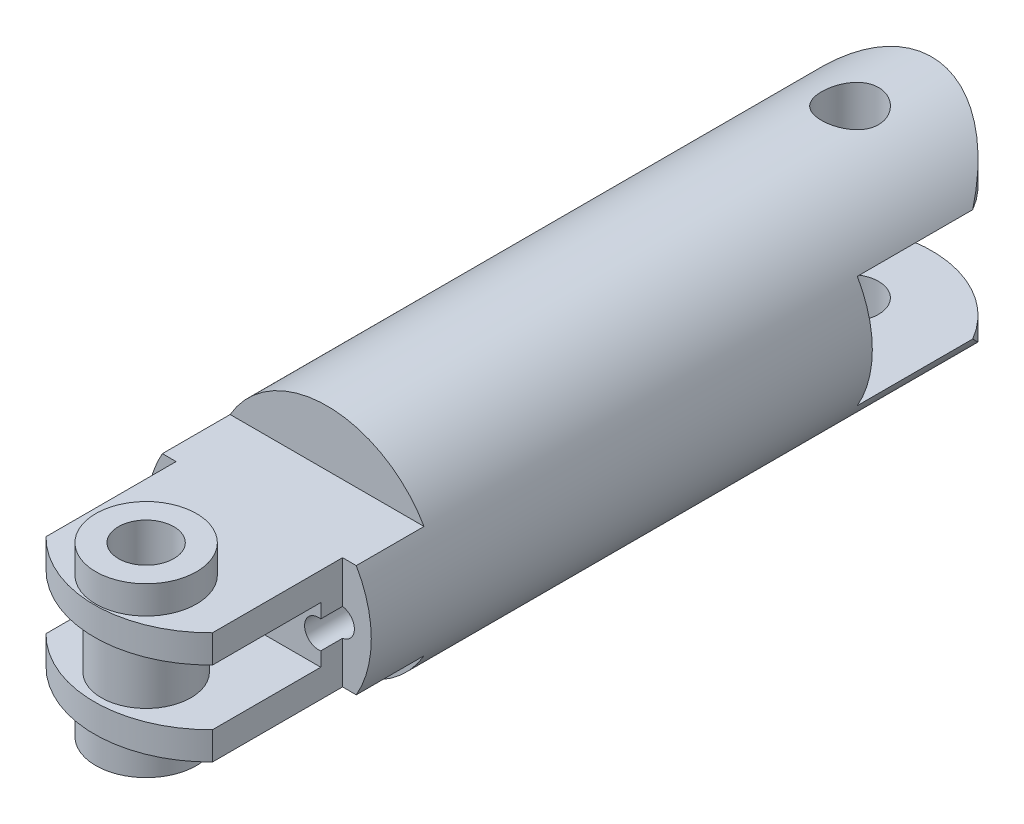
from build123d import *
from build123d.topology import SkipClean

# Parameters (mm, degrees)
SKETCH2_R                       = 10
PHALANGE_LENGTH_DEPTH           = 46.7
BOSS_EXTRUDE3_DEPTH             = 5
BOSS_EXTRUDE4_DEPTH             = 5
BOSS_EXTRUDE4_DEPTH_BACK        = 5
CUT_EXTRUDE2_START              = -15.3025
CUT_EXTRUDE2_DEPTH              = 15.3025
SKETCH7_R                       = 1.65
CUT_EXTRUDE3_DEPTH              = 10
CUT_EXTRUDE4_DEPTH              = 2.5
CUT_EXTRUDE4_DEPTH_BACK         = 2.5
CUT_EXTRUDE7_REACH              = 66.618
SKETCH4_R                       = 1.65
CUT_EXTRUDE7_DIRECTION_2_REACH  = 66.618
CUT_EXTRUDE_THIN1_START         = 46.7
CUT_EXTRUDE_THIN1_DEPTH         = 10.361670454
BOSS_EXTRUDE5_REACH             = 66.084
SKETCH9_R                       = 4
SKETCH9_R_2                     = 1.65
CUT_EXTRUDE8_REACH              = 65.595
SKETCH10_R                      = 1.25
CUT_EXTRUDE9_START              = -8
CUT_EXTRUDE9_DEPTH              = 8
CUT_EXTRUDE10_REACH             = 66.084
CUT_EXTRUDE10_DIRECTION_2_REACH = 66.084
CUT_EXTRUDE11_START             = -10
CUT_EXTRUDE11_OUTLINE_W         = 2.565773848
CUT_EXTRUDE11_OUTLINE_H         = 11.6166929
CUT_EXTRUDE11_DEPTH             = 10
BOSS_EXTRUDE6_START             = 7.5
SKETCH14_R                      = 4.5
SKETCH14_R_2                    = 1.65
BOSS_EXTRUDE6_DEPTH             = 2.5
BOSS_EXTRUDE7_START             = -7.5
SKETCH14_2_R                    = 4.5
SKETCH14_2_R_2                  = 1.65
BOSS_EXTRUDE7_DEPTH             = 2.5
SCALE1_SCALE                    = 0.666666667
CUT_EXTRUDE12_START             = -11.666667
SKETCH15_R                      = 1.65
CUT_EXTRUDE12_DEPTH             = 13.333339
CUT_EXTRUDE13_REACH             = 50.293
SKETCH16_R                      = 1.7
CUT_EXTRUDE13_DIRECTION_2_REACH = 50.293


# Read off the part's stored shape, not the designer's step: Cut-Extrude-Thin1, Cut-Extrude11
with BuildPart() as part:
    # Sketch2 → Phalange Length (new body)
    with BuildSketch(Plane.XY):
        Circle(SKETCH2_R)
    extrude(amount=PHALANGE_LENGTH_DEPTH)

    # Sketch3 → Boss-Extrude3 (add)
    with BuildSketch(Plane(origin=(0, -10, 0), x_dir=(-1, 0, 0), z_dir=(0, -1, 0))):
        with BuildLine():
            Line((-10, 5.302499701), (-10, 0))
            Line((-10, 0), (10, 0))
            Line((10, 0), (10, 5.302499701))
            ThreePointArc((10, 5.302499701), (0, 15.302499701), (-10, 5.302499701))
        make_face()
    boss_extrude3 = extrude(amount=-BOSS_EXTRUDE3_DEPTH)

    # Mirror1: Boss-Extrude3 across plane
    add(boss_extrude3.mirror(Plane.ZX))

    # Sketch5 → Boss-Extrude4 (add, two sides: drawn at the far end of the back side and taken through both)
    with BuildSketch(Plane(origin=(0, 0, 0), x_dir=(1, 0, 0), z_dir=(0, 1, 0)).offset(-BOSS_EXTRUDE4_DEPTH_BACK)):
        with BuildLine():
            Line((-10, -52.483157911), (-10, -46.7))
            Line((-10, -46.7), (10, -46.7))
            Line((10, -46.7), (10, -52.483157911))
            ThreePointArc((10, -52.483157911), (0, -62.051984156), (-10, -52.483157911))
        make_face()
    extrude(amount=BOSS_EXTRUDE4_DEPTH + BOSS_EXTRUDE4_DEPTH_BACK)

    # Sketch6 → Cut-Extrude2 (cut)
    with SkipClean():  # the faces are left unmerged after this step: merging them gives an invalid solid
        with BuildSketch(Plane.XY.offset(CUT_EXTRUDE2_START)):
            with BuildLine():
                ThreePointArc((0, 10), (5, 8.660254038), (8.660254038, 5))
                Line((8.660254038, 5), (10, 5))
                Line((10, 5), (10, 10))
                Line((10, 10), (0, 10))
            make_face()
            with BuildLine():
                Line((10, -5), (8.660254038, -5))
                ThreePointArc((8.660254038, -5), (5, -8.660254038), (0, -10))
                Line((0, -10), (10, -10))
                Line((10, -10), (10, -5))
            make_face()
            with BuildLine():
                ThreePointArc((-8.660254038, 5), (-5, 8.660254038), (0, 10))
                Line((0, 10), (-10, 10))
                Line((-10, 10), (-10, 5))
                Line((-10, 5), (-8.660254038, 5))
            make_face()
            with BuildLine():
                Line((-10, -10), (0, -10))
                ThreePointArc((0, -10), (-5, -8.660254038), (-8.660254038, -5))
                Line((-8.660254038, -5), (-10, -5))
                Line((-10, -5), (-10, -10))
            make_face()
        extrude(amount=CUT_EXTRUDE2_DEPTH, mode=Mode.SUBTRACT)

    # Sketch7 → Cut-Extrude3 (cut)
    with SkipClean():  # the faces are left unmerged after this step: merging them gives an invalid solid
        with BuildSketch(Plane(origin=(0, 5, 0), x_dir=(1, 0, 0), z_dir=(0, 1, 0))):
            with Locations(Location((0, -54.861984156, 0), (0, 0, 270))):
                Circle(SKETCH7_R)
        extrude(amount=-CUT_EXTRUDE3_DEPTH, mode=Mode.SUBTRACT)

    # Sketch5<2> → Cut-Extrude4 (cut, two sides: drawn at the far end of the back side and taken through both)
    with BuildSketch(Plane(origin=(0, 0, 0), x_dir=(1, 0, 0), z_dir=(0, 1, 0)).offset(-CUT_EXTRUDE4_DEPTH_BACK)):
        with BuildLine():
            Line((-10, -52.483157911), (-10, -46.7))
            Line((-10, -46.7), (10, -46.7))
            Line((10, -46.7), (10, -52.483157911))
            ThreePointArc((10, -52.483157911), (0, -62.051984156), (-10, -52.483157911))
        make_face()
    extrude(amount=CUT_EXTRUDE4_DEPTH + CUT_EXTRUDE4_DEPTH_BACK, mode=Mode.SUBTRACT)

    # Sketch4 → Cut-Extrude7 (cut, up to next)
    with BuildSketch(Plane(origin=(0, -5, 0), x_dir=(1, 0, 0), z_dir=(0, 1, 0)), mode=Mode.PRIVATE) as cut_extrude7_sk1:
        with Locations(Location((0, 8.010159673, 0), (0, 0, 270))):
            Circle(SKETCH4_R)
    cut_extrude7_tool1 = extrude(cut_extrude7_sk1.sketch, amount=-CUT_EXTRUDE7_REACH, mode=Mode.PRIVATE) & part.part
    add(cut_extrude7_tool1.solids().sort_by_distance((0, -5, -8.01016))[0], mode=Mode.SUBTRACT)

    # Sketch4 → Cut-Extrude7 direction 2 (cut, up to next)
    with BuildSketch(Plane(origin=(0, -5, 0), x_dir=(1, 0, 0), z_dir=(0, 1, 0)), mode=Mode.PRIVATE) as cut_extrude7_direction_2_sk1:
        with Locations(Location((0, 8.010159673, 0), (0, 0, 270))):
            Circle(SKETCH4_R)
    cut_extrude7_direction_2_tool1 = extrude(cut_extrude7_direction_2_sk1.sketch, amount=CUT_EXTRUDE7_DIRECTION_2_REACH, mode=Mode.PRIVATE) & part.part
    add(cut_extrude7_direction_2_tool1.solids().sort_by_distance((0, -5, -8.01016))[0], mode=Mode.SUBTRACT)

    # Cut-Extrude-Thin1 outline → Cut-Extrude-Thin1 (cut)
    with SkipClean():  # the faces are left unmerged after this step: merging them gives an invalid solid
        with BuildSketch(Plane.XY.offset(CUT_EXTRUDE_THIN1_START)):
            with BuildLine():
                ThreePointArc((8.660254038, 5), (9.256147934, 3.78466979), (9.682458366, 2.5))
                Line((9.682458366, 2.5), (10, 2.5))
                Line((10, 2.5), (10, 5))
                Line((10, 5), (8.660254038, 5))
            make_face()
            with BuildLine():
                Line((10, -2.5), (9.682458366, -2.5))
                ThreePointArc((9.682458366, -2.5), (9.256147934, -3.78466979), (8.660254038, -5))
                Line((8.660254038, -5), (10, -5))
                Line((10, -5), (10, -2.5))
            make_face()
            with BuildLine():
                Line((-10, 2.5), (-9.682458366, 2.5))
                ThreePointArc((-9.682458366, 2.5), (-9.256147934, 3.78466979), (-8.660254038, 5))
                Line((-8.660254038, 5), (-10, 5))
                Line((-10, 5), (-10, 2.5))
            make_face()
            with BuildLine():
                ThreePointArc((-8.660254038, -5), (-9.256147934, -3.78466979), (-9.682458366, -2.5))
                Line((-9.682458366, -2.5), (-10, -2.5))
                Line((-10, -2.5), (-10, -5))
                Line((-10, -5), (-8.660254038, -5))
            make_face()
        extrude(amount=CUT_EXTRUDE_THIN1_DEPTH, mode=Mode.SUBTRACT)

    # Sketch9 → Boss-Extrude5 (add, up to next)
    with BuildSketch(Plane.XZ.offset(-2.5), mode=Mode.PRIVATE) as boss_extrude5_sk1:
        with Locations(Location((0, 54.861984156, 0), (0, 0, 90))):
            Circle(SKETCH9_R)
        with Locations(Location((0, 54.861984156, 0), (0, 0, 90))):
            Circle(SKETCH9_R_2, mode=Mode.SUBTRACT)
    boss_extrude5_tool1 = extrude(boss_extrude5_sk1.sketch, amount=BOSS_EXTRUDE5_REACH, mode=Mode.PRIVATE) - part.part
    add(boss_extrude5_tool1.solids().sort_by_distance((0, 2.5, 50.975121))[0])

    # Sketch10 → Cut-Extrude8 (cut, up to next)
    with BuildSketch(Plane.XY.offset(46.7), mode=Mode.PRIVATE) as cut_extrude8_sk1:
        with Locations((7.239961745, 0)):
            Circle(SKETCH10_R)
    cut_extrude8_tool1 = extrude(cut_extrude8_sk1.sketch, amount=-CUT_EXTRUDE8_REACH, mode=Mode.PRIVATE) & part.part
    # Sketch10 → Cut-Extrude8 (cut, up to next)
    with BuildSketch(Plane.XY.offset(46.7), mode=Mode.PRIVATE) as cut_extrude8_sk2:
        with Locations((-7.239961745, 0)):
            Circle(SKETCH10_R)
    cut_extrude8_tool2 = extrude(cut_extrude8_sk2.sketch, amount=-CUT_EXTRUDE8_REACH, mode=Mode.PRIVATE) & part.part
    add(cut_extrude8_tool1.solids().sort_by_distance((7.239962, 0, 46.7))[0], mode=Mode.SUBTRACT)
    add(cut_extrude8_tool2.solids().sort_by_distance((-7.239962, 0, 46.7))[0], mode=Mode.SUBTRACT)

    # Sketch11 → Cut-Extrude9 (cut)
    with SkipClean():  # the faces are left unmerged after this step: merging them gives an invalid solid
        with BuildSketch(Plane.XY.offset(46.7).offset(CUT_EXTRUDE9_START)):
            with BuildLine():
                ThreePointArc((8.660254038, 5), (0, 10), (-8.660254038, 5))
                Line((-8.660254038, 5), (8.660254038, 5))
            make_face()
            with BuildLine():
                Line((8.660254038, -5), (-8.660254038, -5))
                ThreePointArc((-8.660254038, -5), (0, -10), (8.660254038, -5))
            make_face()
        extrude(amount=CUT_EXTRUDE9_DEPTH, mode=Mode.SUBTRACT)

    # Sketch12 → Cut-Extrude10 (cut, up to next)
    with BuildSketch(Plane.XZ.offset(-2.5), mode=Mode.PRIVATE) as cut_extrude10_sk1:
        with BuildLine():
            ThreePointArc((0, 62.051984156), (-5.99753031, 60.05625831), (-9.603498629, 54.864892021))
            Line((-9.603498629, 54.864892021), (-8.660254038, 54.864892021))
            ThreePointArc((-8.660254038, 54.864892021), (0, 59.490740593), (8.660254038, 54.864892021))
            Line((8.660254038, 54.864892021), (9.603498629, 54.864892021))
            ThreePointArc((9.603498629, 54.864892021), (5.99753031, 60.05625831), (0, 62.051984156))
        make_face()
    cut_extrude10_tool1 = extrude(cut_extrude10_sk1.sketch, amount=CUT_EXTRUDE10_REACH, mode=Mode.PRIVATE) & part.part
    add(cut_extrude10_tool1.solids().sort_by_distance((5.874655, 2.5, 59.89207))[0], mode=Mode.SUBTRACT)

    # Sketch12 → Cut-Extrude10 direction 2 (cut, up to next)
    with BuildSketch(Plane.XZ.offset(-2.5), mode=Mode.PRIVATE) as cut_extrude10_direction_2_sk1:
        with BuildLine():
            ThreePointArc((0, 62.051984156), (-5.99753031, 60.05625831), (-9.603498629, 54.864892021))
            Line((-9.603498629, 54.864892021), (-8.660254038, 54.864892021))
            ThreePointArc((-8.660254038, 54.864892021), (0, 59.490740593), (8.660254038, 54.864892021))
            Line((8.660254038, 54.864892021), (9.603498629, 54.864892021))
            ThreePointArc((9.603498629, 54.864892021), (5.99753031, 60.05625831), (0, 62.051984156))
        make_face()
    cut_extrude10_direction_2_tool1 = extrude(cut_extrude10_direction_2_sk1.sketch, amount=-CUT_EXTRUDE10_DIRECTION_2_REACH, mode=Mode.PRIVATE) & part.part
    add(cut_extrude10_direction_2_tool1.solids().sort_by_distance((5.874655, 2.5, 59.89207))[0], mode=Mode.SUBTRACT)

    # Cut-Extrude11 outline → Cut-Extrude11 (cut)
    with BuildSketch(Plane.XZ.offset(5).offset(CUT_EXTRUDE11_START)):
        with Locations((-8.717113076, 50.560571369)):
            Rectangle(CUT_EXTRUDE11_OUTLINE_W, CUT_EXTRUDE11_OUTLINE_H)
        with Locations((8.717113076, 50.560571369)):
            Rectangle(CUT_EXTRUDE11_OUTLINE_W, CUT_EXTRUDE11_OUTLINE_H)
    extrude(amount=CUT_EXTRUDE11_DEPTH, mode=Mode.SUBTRACT)

    # Sketch14 → Boss-Extrude6 (add)
    with SkipClean():  # the faces are left unmerged after this step: merging them gives an invalid solid
        with BuildSketch(Plane(origin=(0, 0, 0), x_dir=(1, 0, 0), z_dir=(0, 1, 0)).offset(BOSS_EXTRUDE6_START)):
            with Locations(Location((0, -54.861984156, 0), (0, 0, 270))):
                Circle(SKETCH14_R)
            with Locations(Location((0, -54.861984156, 0), (0, 0, 270))):
                Circle(SKETCH14_R_2, mode=Mode.SUBTRACT)
        extrude(amount=-BOSS_EXTRUDE6_DEPTH)

    # Sketch14<2> → Boss-Extrude7 (add)
    with SkipClean():  # the faces are left unmerged after this step: merging them gives an invalid solid
        with BuildSketch(Plane(origin=(0, 0, 0), x_dir=(1, 0, 0), z_dir=(0, 1, 0)).offset(BOSS_EXTRUDE7_START)):
            with Locations(Location((0, -54.861984156, 0), (0, 0, 270))):
                Circle(SKETCH14_2_R)
            with Locations(Location((0, -54.861984156, 0), (0, 0, 270))):
                Circle(SKETCH14_2_R_2, mode=Mode.SUBTRACT)
        extrude(amount=BOSS_EXTRUDE7_DEPTH)


with BuildPart() as part_1:
    # Scale1: scaled about (0, 4.3e-08, 21.33862286)
    add(part.part.scale(SCALE1_SCALE).moved(Location((0, 1.4e-08, 7.112874287))))

    # Sketch15 → Cut-Extrude12 (cut)
    with BuildSketch(Plane(origin=(0, 4.999994977, 0), x_dir=(1, 0, 0), z_dir=(0, 1, 0)).offset(CUT_EXTRUDE12_START)):
        with Locations(Location((-5.6e-08, -43.687701746, 0), (0, 0, 270))):
            Circle(SKETCH15_R)
    extrude(amount=CUT_EXTRUDE12_DEPTH, mode=Mode.SUBTRACT)

    # Sketch16 → Cut-Extrude13 (cut, up to next)
    with BuildSketch(Plane.XZ.offset(-3.333328311), mode=Mode.PRIVATE) as cut_extrude13_sk1:
        with Locations(Location((-5.6e-08, 1.772939193, 0), (0, 0, 270))):
            Circle(SKETCH16_R)
    cut_extrude13_tool1 = extrude(cut_extrude13_sk1.sketch, amount=-CUT_EXTRUDE13_REACH, mode=Mode.PRIVATE) & part_1.part
    add(cut_extrude13_tool1.solids().sort_by_distance((0, 3.333328, 1.772939))[0], mode=Mode.SUBTRACT)

    # Sketch16 → Cut-Extrude13 direction 2 (cut, up to next)
    with BuildSketch(Plane.XZ.offset(-3.333328311), mode=Mode.PRIVATE) as cut_extrude13_direction_2_sk1:
        with Locations(Location((-5.6e-08, 1.772939193, 0), (0, 0, 270))):
            Circle(SKETCH16_R)
    cut_extrude13_direction_2_tool1 = extrude(cut_extrude13_direction_2_sk1.sketch, amount=CUT_EXTRUDE13_DIRECTION_2_REACH, mode=Mode.PRIVATE) & part_1.part
    add(cut_extrude13_direction_2_tool1.solids().sort_by_distance((0, 3.333328, 1.772939))[0], mode=Mode.SUBTRACT)


solid = part_1.part
